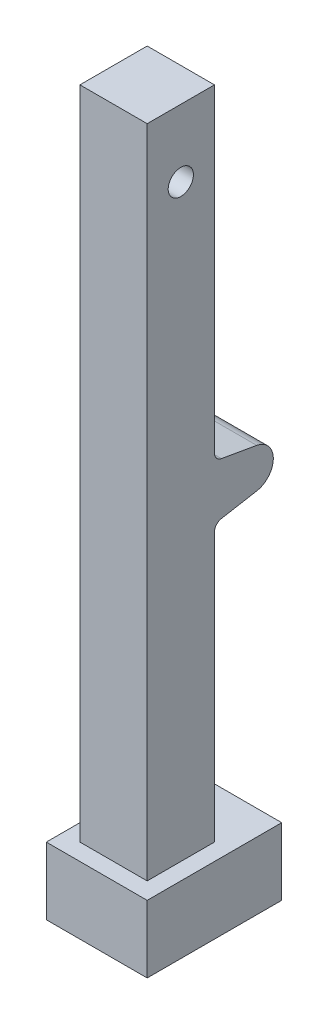
from build123d import *

# Parameters (mm, degrees)
SKETCH1_R           = 37.5
BOSS_EXTRUDE1_DEPTH = 100
DRAFT1_ANGLE        = 10
SKETCH1_3_W         = 200
SKETCH1_3_H         = 400
BOSS_EXTRUDE2_DEPTH = 150
FILLET1_R           = 59.58768
FILLET2_R           = 25


with BuildPart() as part:
    # Sketch1 → Boss-Extrude1 (new, symmetric)
    with BuildSketch(Plane.YZ):
        Polygon((-900, -100), (-2000, -100), (-2000, 100), (200, 100), (200, -100), (-800, -100), (-800, -275), (-900, -275), align=None)
        with Locations(Location((0, 0, 0), (0, 0, 270))):
            Circle(SKETCH1_R, mode=Mode.SUBTRACT)
    extrude(amount=BOSS_EXTRUDE1_DEPTH, both=True)

    # Draft1
    draft1_faces = [part.faces().sort_by_distance(p)[0] for p in [
        (0, -800, -187.5),
        (0, -900, -187.5),
    ]]
    draft(draft1_faces, Plane(origin=(100, 0, -275), x_dir=(-1, 0, 0), z_dir=(0, 0, -1)), DRAFT1_ANGLE)

    # Sketch1<3> → Boss-Extrude2 (add, symmetric)
    with BuildSketch(Plane.YZ):
        with Locations((-1850, -50)):
            Rectangle(SKETCH1_3_W, SKETCH1_3_H)
    extrude(amount=BOSS_EXTRUDE2_DEPTH, both=True)

    # Fillet1
    fillet1_edges = [part.edges().sort_by_distance(p)[0] for p in [
        (0, -800, -275),
        (0, -900, -275),
    ]]
    fillet(fillet1_edges, radius=FILLET1_R - 0.0001)  # a hair under: the kernel refuses the full size

    # Fillet2
    fillet2_edges = [part.edges().sort_by_distance(p)[0] for p in [
        (0, -769.142778376, -100),
        (0, -930.857221624, -100),
    ]]
    fillet(fillet2_edges, radius=FILLET2_R)


solid = part.part
